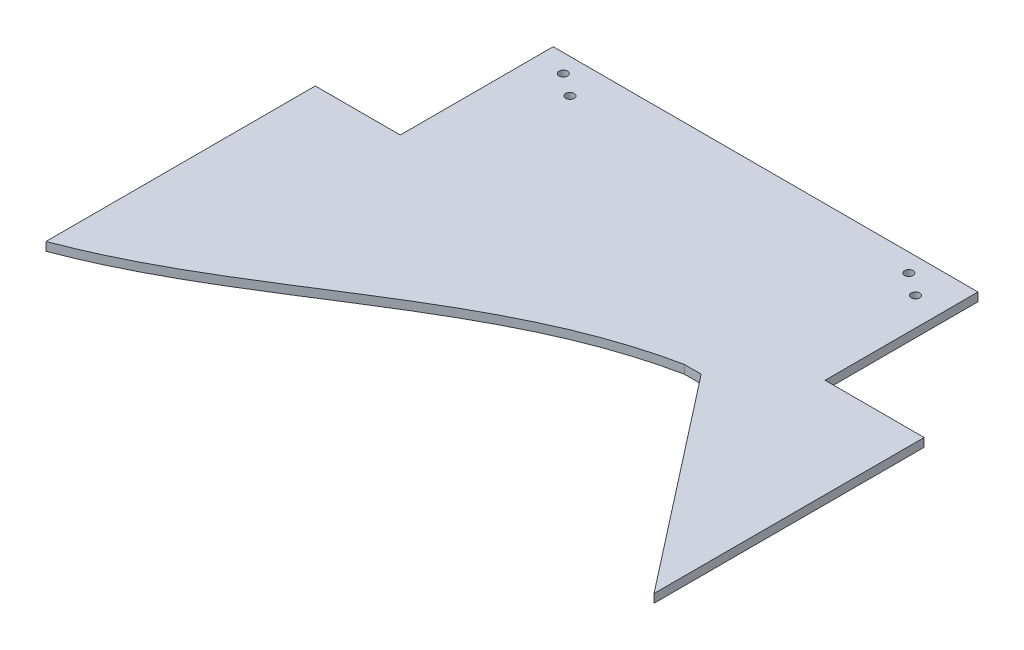
from build123d import *

# Parameters (mm, degrees)
SKETCH1_R           = 1.5
BOSS_EXTRUDE1_DEPTH = 3


with BuildPart() as part:
    # Sketch1 → Boss-Extrude1 (new body)
    with BuildSketch(Plane(origin=(0, 0, 0), x_dir=(1, 0, 0), z_dir=(0, 1, 0))):
        with BuildLine():
            add(Edge.make_bspline(
                [(45.281536872, -37), (-12.284726177, -48.689174516), (-51.82483075, -92.30412262), (-105, -112.092029096)],
                knots=[0, 0, 0, 0, 1, 1, 1, 1], degree=3))
            Line((45.281536872, -37), (51.259707723, -37))
            Line((51.259707723, -37), (110, -112.392253356))
            Line((110, -112.392253356), (110, -17))
            Line((110, -17), (75, -17))
            Line((75, -17), (75, 37))
            Line((75, 37), (-75, 37))
            Line((-75, 37), (-75, -17))
            Line((-75, -17), (-105, -17))
            Line((-105, -17), (-105, -112.092029096))
        make_face()
        with Locations((57, 30.573337052)):
            Circle(SKETCH1_R, mode=Mode.SUBTRACT)
        with Locations((-57, 24.912803627)):
            Circle(SKETCH1_R, mode=Mode.SUBTRACT)
        with Locations((-65, 30.573337052)):
            Circle(SKETCH1_R, mode=Mode.SUBTRACT)
        with Locations((65, 24.912803627)):
            Circle(SKETCH1_R, mode=Mode.SUBTRACT)
    extrude(amount=BOSS_EXTRUDE1_DEPTH)


solid = part.part
